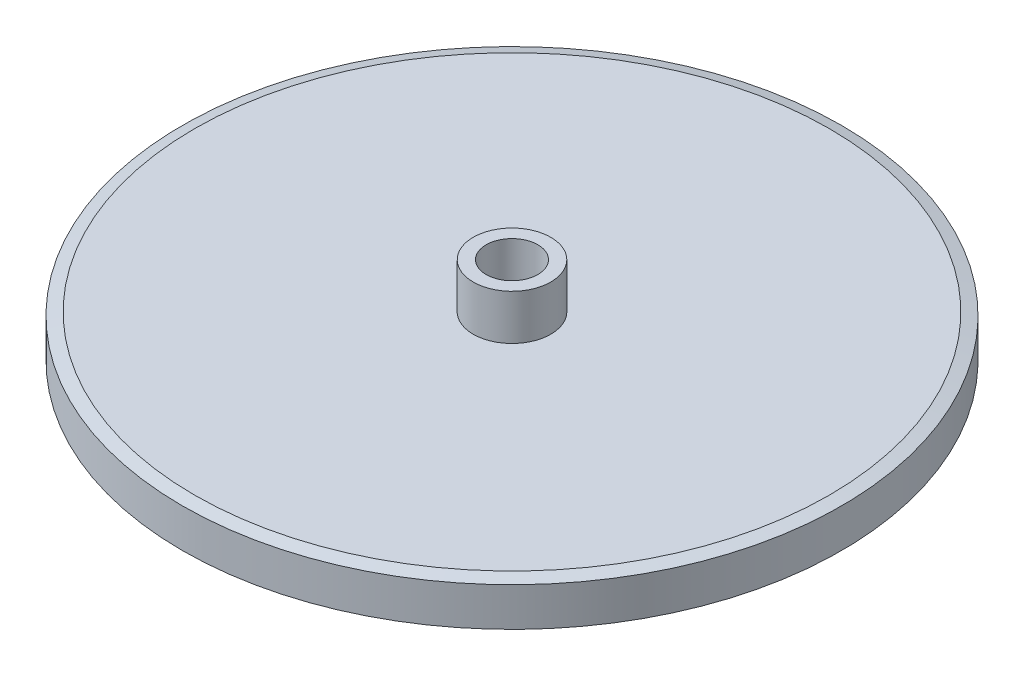
from build123d import *

# Parameters (mm, degrees)
CHAMFER_1_SIZE           = 0.94
CHAMFER_1_SIZE2          = 0.251872241
CUT_EXTRUDE_3_DEPTH      = 37.735541373
CUT_EXTRUDE_3_DEPTH_BACK = 37.735541373
SKETCH_2_R               = 2
CHAMFER_2_SIZE           = 0.94
CHAMFER_2_SIZE2          = 0.251872241


with BuildPart() as part:
    # Эскиз1 → Повернуть2 (revolve)
    with BuildSketch(Plane.XY):
        Polygon((0, 0), (25.5, 0), (25.5, 3.5), (3, 3.5), (3, 7), (0, 7), align=None)
    revolve(axis=Axis((0, 7, 0), (0, -1, 0)))

    # Фаска1
    chamfer_1_edges = [part.edges().sort_by_distance(p)[0] for p in [
        (-25.5, 3.5, 0),
    ]]
    chamfer_1_side = [part.faces().sort_by_distance(p)[0] for p in [
        (-24.778751083, 3.5, 0),
    ]]
    chamfer(chamfer_1_edges, length=CHAMFER_1_SIZE, length2=CHAMFER_1_SIZE2, reference=chamfer_1_side[0])

    # Эскиз2 → Вырез-Вытянуть3 (cut, two sides: drawn at the far end of the back side and taken through both)
    with BuildSketch(Plane(origin=(0, 0, 0), x_dir=(-1, 0, 0), z_dir=(0, -1, 0)).offset(-CUT_EXTRUDE_3_DEPTH_BACK)):
        Circle(SKETCH_2_R)
    extrude(amount=CUT_EXTRUDE_3_DEPTH + CUT_EXTRUDE_3_DEPTH_BACK, mode=Mode.SUBTRACT)

    # Фаска2
    chamfer_2_edges = [part.edges().sort_by_distance(p)[0] for p in [
        (-25.5, 0, 0),
    ]]
    chamfer_2_side = [part.faces().sort_by_distance(p)[0] for p in [
        (-24.778751083, 0, 0),
    ]]
    chamfer(chamfer_2_edges, length=CHAMFER_2_SIZE, length2=CHAMFER_2_SIZE2, reference=chamfer_2_side[0])


solid = part.part
